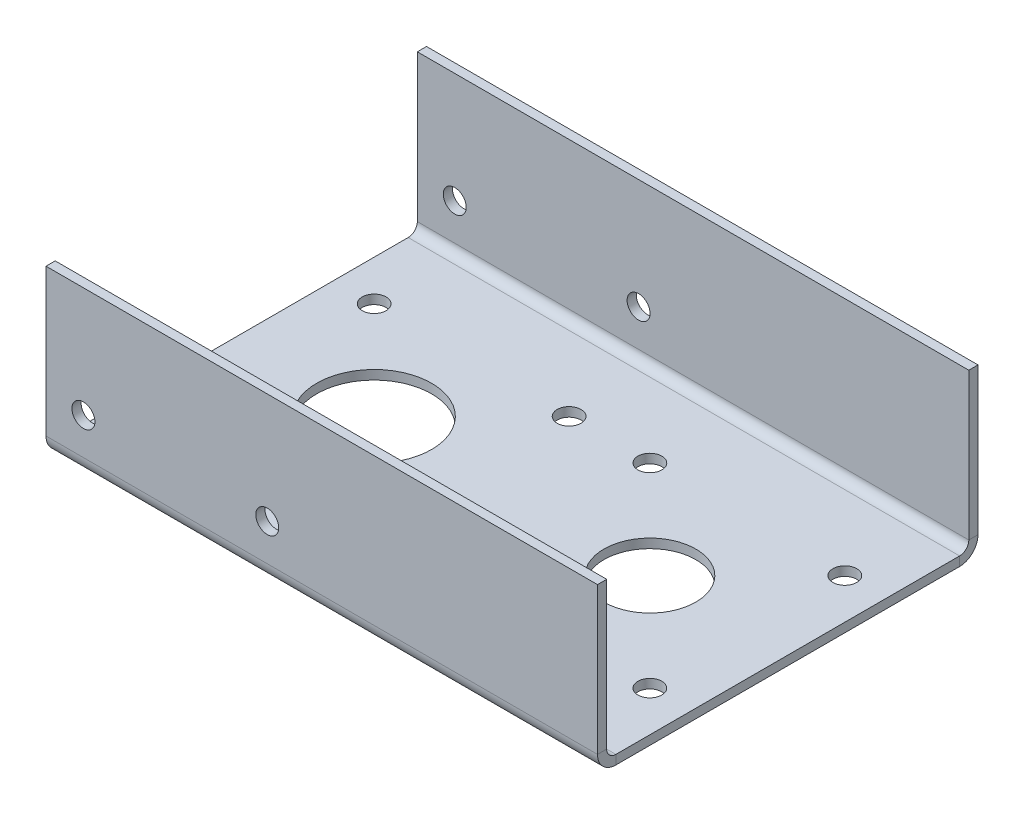
from build123d import *

# Parameters (mm, degrees)
SKETCH1_W                    = 76.2
SKETCH1_H                    = 50.038
SKETCH1_R                    = 7.9375
BASE_FLANGE1_DEPTH           = 1.27
EDGE_FLANGE1_STRIP_W         = 7.62
EDGE_FLANGE1_STRIP_H         = 1.27
EDGE_FLANGE1_STRIP_CUT_DEPTH = 76.2
EDGE_FLANGE1_DEPTH           = 76.2
SKETCH9_R                    = 1.651
CUT_EXTRUDE3_DEPTH           = 52.076899093
CIRPATTERN2_COUNT            = 4
SKETCH11_R                   = 6.35
SKETCH11_R_2                 = 1.651
CUT_EXTRUDE4_DEPTH           = 2.54
CIRPATTERN3_COUNT            = 4
CUT_EXTRUDE2_DEPTH           = 69.426487445
CUT_EXTRUDE2_DEPTH_BACK      = 69.426487445
SKETCH10_R                   = 1.5875


# Sheet-metal steps are written as plain solids
with BuildPart() as part:
    # Sketch1 → Base-Flange1 (new body)
    with BuildSketch(Plane(origin=(0, 0, 0), x_dir=(1, 0, 0), z_dir=(0, 1, 0))):
        Rectangle(SKETCH1_W, SKETCH1_H)
        with Locations(Location((-19.05, 0, 0), (0, 0, 270))):
            Circle(SKETCH1_R, mode=Mode.SUBTRACT)
    extrude(amount=-BASE_FLANGE1_DEPTH)

    # Edge-Flange1 strip (across the edge) → Edge-Flange1 strip cut (cut)
    with BuildSketch(Plane(origin=(-38.1, 0, 25.019), x_dir=(0, 0, -1), z_dir=(1, 0, 0))):
        with Locations((-2.54, -0.635)):
            Rectangle(EDGE_FLANGE1_STRIP_W, EDGE_FLANGE1_STRIP_H)
    edge_flange1_strip_cut = extrude(amount=EDGE_FLANGE1_STRIP_CUT_DEPTH, mode=Mode.SUBTRACT)

    # Edge-Flange1 section (across the edge) → Edge-Flange1 (add)
    with BuildSketch(Plane(origin=(-38.1, 0, 25.019), x_dir=(0, 0, -1), z_dir=(1, 0, 0))):
        with BuildLine():
            Line((-1.27, 1.27), (-1.27, 21.59))
            Line((-1.27, 21.59), (0, 21.59))
            Line((0, 21.59), (0, 1.27))
            ThreePointArc((0, 1.27), (0.371974388, 0.371974388), (1.27, 0))
            Line((1.27, 0), (1.27, -1.27))
            ThreePointArc((1.27, -1.27), (-0.526051224, -0.526051224), (-1.27, 1.27))
        make_face()
    edge_flange1 = extrude(amount=EDGE_FLANGE1_DEPTH)

    # Mirror1: Edge-Flange1 strip cut, Edge-Flange1 across plane
    add(edge_flange1_strip_cut.mirror(Plane.XY), mode=Mode.SUBTRACT)
    add(edge_flange1.mirror(Plane.XY))

    # Sketch9 → Cut-Extrude3 (cut, through all)
    with BuildSketch(Plane(origin=(0, 0, 0), x_dir=(1, 0, 0), z_dir=(0, 1, 0))):
        with Locations(Location((-32.520384182, 13.470384182, 0), (0, 0, 270))):
            Circle(SKETCH9_R)
    cut_extrude3 = extrude(amount=-CUT_EXTRUDE3_DEPTH, mode=Mode.SUBTRACT)

    # CirPattern2: Cut-Extrude3 ×4 about axis
    cirpattern2_axis = Axis((-19.05, 0, 0), (0, 1, 0))
    for i in range(1, CIRPATTERN2_COUNT):
        add(cut_extrude3.rotate(cirpattern2_axis, i * 360 / CIRPATTERN2_COUNT), mode=Mode.SUBTRACT)

    # Sketch11 → Cut-Extrude4 (cut)
    with BuildSketch(Plane(origin=(0, 0, 0), x_dir=(1, 0, 0), z_dir=(0, 1, 0))):
        with Locations(Location((19.05, 0, 0), (0, 0, 270))):
            Circle(SKETCH11_R)
        with Locations(Location((5.579615818, 13.470384182, 0), (0, 0, 270))):
            Circle(SKETCH11_R_2)
    cut_extrude4 = extrude(amount=-CUT_EXTRUDE4_DEPTH, mode=Mode.SUBTRACT)

    # CirPattern3: Cut-Extrude4 ×4 about axis
    cirpattern3_axis = Axis((19.05, 0, 0), (0, 1, 0))
    for i in range(1, CIRPATTERN3_COUNT):
        add(cut_extrude4.rotate(cirpattern3_axis, i * 360 / CIRPATTERN3_COUNT), mode=Mode.SUBTRACT)

    # Sketch10 → Cut-Extrude2 (cut, two sides: drawn at the far end of the back side and taken through both)
    with BuildSketch(Plane(origin=(0, 0, -26.289), x_dir=(-1, 0, 0), z_dir=(0, 0, -1)).offset(-CUT_EXTRUDE2_DEPTH_BACK)):
        with Locations((7.52856, 6.35)):
            Circle(SKETCH10_R)
        with Locations((32.92856, 6.35)):
            Circle(SKETCH10_R)
    extrude(amount=CUT_EXTRUDE2_DEPTH + CUT_EXTRUDE2_DEPTH_BACK, mode=Mode.SUBTRACT)


solid = part.part
